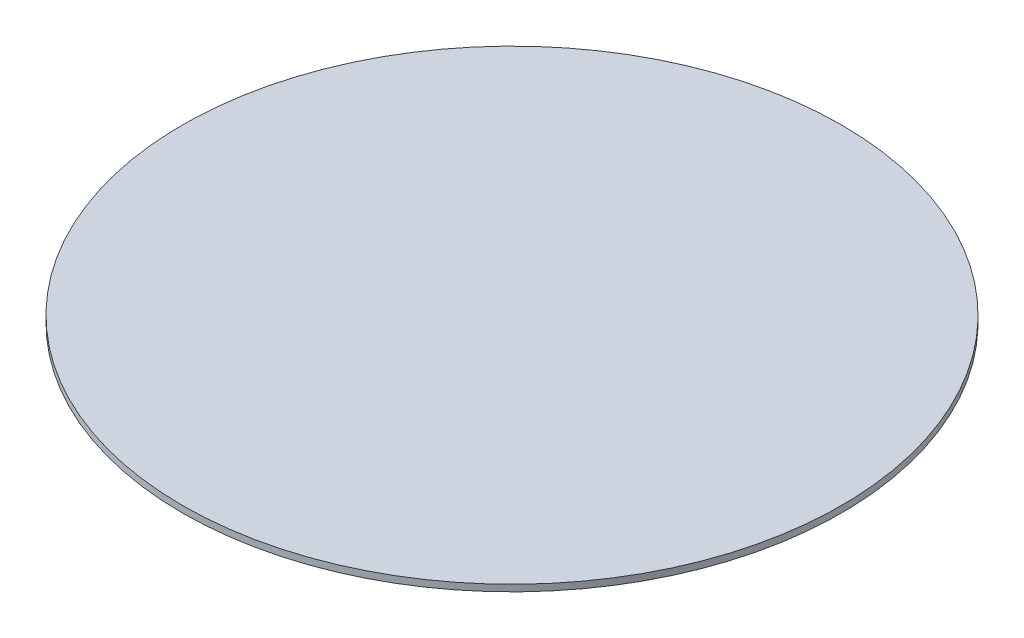
from build123d import *

# Parameters (mm, degrees)
SKETCH1_R           = 250
BOSS_EXTRUDE1_DEPTH = 5


with BuildPart() as part:
    # Sketch1 → Boss-Extrude1 (new body)
    with BuildSketch(Plane(origin=(0, 0, 0), x_dir=(1, 0, 0), z_dir=(0, 1, 0))):
        Circle(SKETCH1_R)
    extrude(amount=BOSS_EXTRUDE1_DEPTH)


solid = part.part
